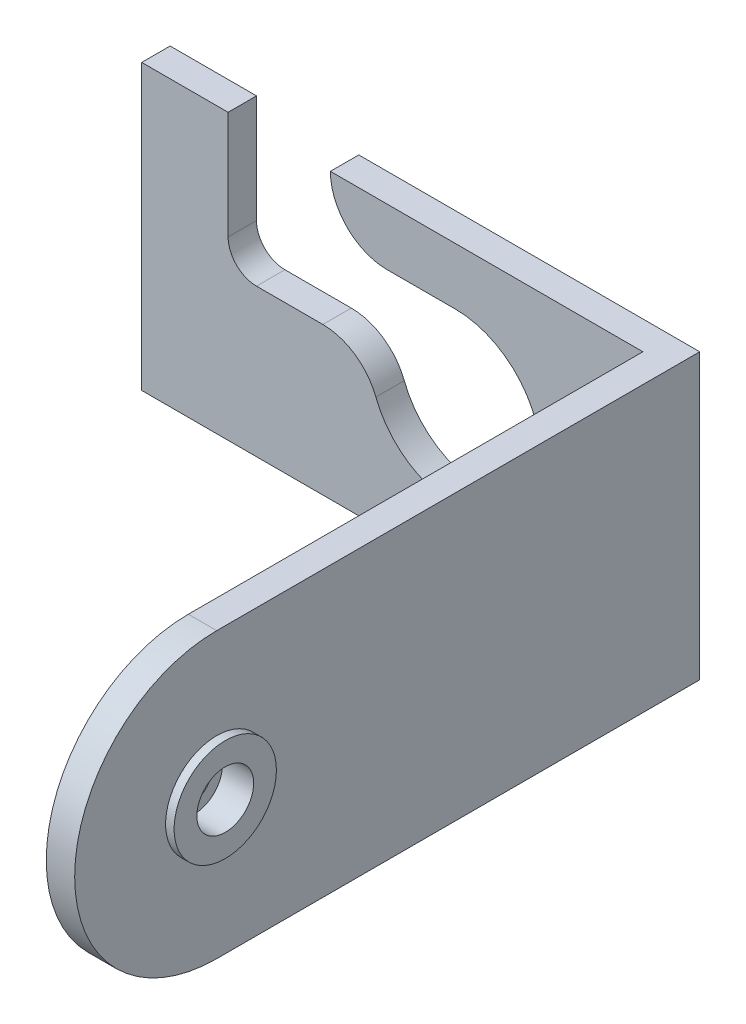
from build123d import *
from build123d.topology import SkipClean

# Parameters (mm, degrees)
SKETCH1_R                = 1.5
BOSS_EXTRUDE1_DEPTH      = 2.5
BOSS_EXTRUDE2_DEPTH      = 1.8
BOSS_EXTRUDE2_DEPTH_BACK = 2.5
SKETCH2_R                = 4.5
SKETCH2_R_2              = 1.5
SKETCH4_R                = 2.5
CUT_EXTRUDE1_DEPTH       = 2
BOSS_EXTRUDE3_START      = 0.75
SKETCH5_R                = 4.5
SKETCH5_R_2              = 2.5
BOSS_EXTRUDE3_DEPTH      = 0.75
SKETCH6_W                = 46.6
SKETCH6_H                = 25
BOSS_EXTRUDE4_DEPTH      = 2.5
CUT_EXTRUDE2_REACH       = 71.694


with BuildPart() as part:
    # Sketch1 → Boss-Extrude1 (new body)
    with BuildSketch(Plane(origin=(0, 0, 0), x_dir=(0, 0, -1), z_dir=(1, 0, 0))):
        with BuildLine():
            Line((0, 12.5), (42.5, 12.5))
            Line((42.5, 12.5), (42.5, -12.5))
            Line((42.5, -12.5), (0, -12.5))
            ThreePointArc((0, -12.5), (-12.5, 0), (0, 12.5))
        make_face()
        Circle(SKETCH1_R, mode=Mode.SUBTRACT)
    extrude(amount=BOSS_EXTRUDE1_DEPTH)

    # Sketch2 → Boss-Extrude2 (add, two sides: drawn at the far end of the back side and taken through both)
    with BuildSketch(Plane.ZY.offset(-BOSS_EXTRUDE2_DEPTH_BACK)):
        Circle(SKETCH2_R)
        Circle(SKETCH2_R_2, mode=Mode.SUBTRACT)
    extrude(amount=BOSS_EXTRUDE2_DEPTH + BOSS_EXTRUDE2_DEPTH_BACK)

    # Sketch4 → Cut-Extrude1 (cut)
    with BuildSketch(Plane(origin=(2.5, 0, 0), x_dir=(0, 0, -1), z_dir=(1, 0, 0))):
        Circle(SKETCH4_R)
    extrude(amount=-CUT_EXTRUDE1_DEPTH, mode=Mode.SUBTRACT)

    # Sketch5 → Boss-Extrude3 (add)
    with SkipClean():  # the faces are left unmerged after this step: merging them gives an invalid solid
        with BuildSketch(Plane(origin=(2.5, 0, 0), x_dir=(0, 0, -1), z_dir=(1, 0, 0)).offset(BOSS_EXTRUDE3_START)):
            with Locations(Location((0, 0, 0), (0, 0, 180))):
                Circle(SKETCH5_R)
            Circle(SKETCH5_R_2, mode=Mode.SUBTRACT)
        extrude(amount=-BOSS_EXTRUDE3_DEPTH)

    # Sketch6 → Boss-Extrude4 (add)
    with SkipClean():  # the faces are left unmerged after this step: merging them gives an invalid solid
        with BuildSketch(Plane(origin=(0, 0, -42.5), x_dir=(-1, 0, 0), z_dir=(0, 0, -1))):
            with Locations((20.8, 0)):
                Rectangle(SKETCH6_W, SKETCH6_H)
        extrude(amount=-BOSS_EXTRUDE4_DEPTH)
    add(part.part.scale(1), mode=Mode.REPLACE)  # the faces are merged on a copy

    # Sketch7 → Cut-Extrude2 (cut, up to next)
    with BuildSketch(Plane.XY.offset(-40), mode=Mode.PRIVATE) as cut_extrude2_sk1:
        with BuildLine():
            Line((-27.5, 12.5), (-36.5, 12.5))
            Line((-36.5, 12.5), (-36.5, 3))
            ThreePointArc((-36.5, 3), (-35.767766953, 1.232233047), (-34, 0.5))
            Line((-34, 0.5), (-28.16190379, 0.5))
            ThreePointArc((-28.16190379, 0.5), (-25.333476665, -0.376894374), (-23.497142274, -2.7))
            ThreePointArc((-23.497142274, -2.7), (-10.315341562, -4.242640687), (-16.5, 7.5))
            Line((-16.5, 7.5), (-22.5, 7.5))
            ThreePointArc((-22.5, 7.5), (-26.035533906, 8.964466094), (-27.5, 12.5))
        make_face()
    cut_extrude2_tool1 = extrude(cut_extrude2_sk1.sketch, amount=-CUT_EXTRUDE2_REACH, mode=Mode.PRIVATE) & part.part
    add(cut_extrude2_tool1.solids().sort_by_distance((-22.661838, 2.786009, -40))[0], mode=Mode.SUBTRACT)


solid = part.part
